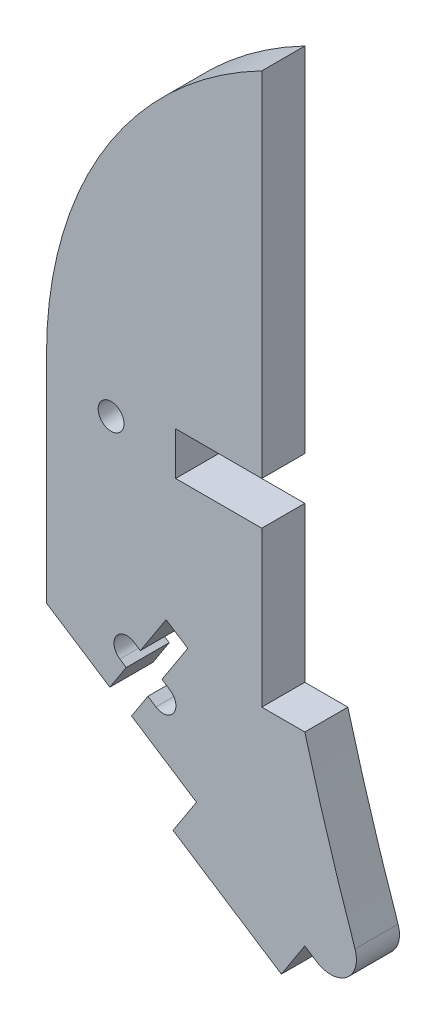
from build123d import *

# Parameters (mm, degrees)
SKETCH1_R           = 1.5
BOSS_EXTRUDE1_DEPTH = 5
BOSS_EXTRUDE2_DEPTH = 5


with BuildPart() as part:
    # Sketch1 → Boss-Extrude1 (new body)
    with BuildSketch(Plane.XY):
        with BuildLine():
            Line((-2.723195175, -4.19335284), (0, 0))
            Line((0, 0), (0, 21.523344663))
            Line((0, 21.523344663), (-5, 21.523344663))
            Line((-5, 21.523344663), (-5, 39.523344663))
            Line((-5, 39.523344663), (-15, 39.523344663))
            Line((-15, 39.523344663), (-15, 44.523344663))
            Line((-15, 44.523344663), (-5, 44.523344663))
            Line((-5, 44.523344663), (-5, 85.523344663))
            ThreePointArc((-5, 85.523344663), (-23.257079628, 68.53375907), (-30, 44.523344663))
            Line((-30, 44.523344663), (-30, 19.482227796))
            Line((-30, 19.482227796), (-22.644105335, 14.705253945))
            Line((-22.644105335, 14.705253945), (-20.737868712, 17.640600933))
            Line((-20.737868712, 17.640600933), (-21.480469057, 18.122851236))
            ThreePointArc((-21.480469057, 18.122851236), (-21.921516356, 20.19781564), (-19.846551952, 20.63886294))
            Line((-19.846551952, 20.63886294), (-19.103951607, 20.156612637))
            Line((-19.103951607, 20.156612637), (-16.108436914, 24.769300761))
            Line((-16.108436914, 24.769300761), (-13.592425211, 23.135383656))
            Line((-13.592425211, 23.135383656), (-16.587939903, 18.522695532))
            Line((-16.587939903, 18.522695532), (-15.653199112, 17.915667765))
            ThreePointArc((-15.653199112, 17.915667765), (-15.212151813, 15.84070336), (-17.287116217, 15.399656061))
            Line((-17.287116217, 15.399656061), (-18.221857008, 16.006683828))
            Line((-18.221857008, 16.006683828), (-20.128093631, 13.07133684))
            Line((-20.128093631, 13.07133684), (-12.580058519, 8.169585525))
            Line((-12.580058519, 8.169585525), (-15.303253694, 3.976232685))
            Line((-15.303253694, 3.976232685), (-2.723195175, -4.19335284))
        make_face()
        with Locations((-22.5, 42.023344663)):
            Circle(SKETCH1_R, mode=Mode.SUBTRACT)
    extrude(amount=BOSS_EXTRUDE1_DEPTH)

    # Sketch2 → Boss-Extrude2 (add)
    with BuildSketch(Plane.XY.offset(5)):
        with BuildLine():
            Line((0, 0), (1.366082895, -0.887144605))
            ThreePointArc((1.366082895, -0.887144605), (4.849577495, -0.733136942), (5.834405315, 2.61179462))
            ThreePointArc((5.834405315, 2.61179462), (2.753784423, 12.017153456), (0, 21.523344663))
            Line((0, 21.523344663), (0, 0))
        make_face()
    extrude(amount=-BOSS_EXTRUDE2_DEPTH)


solid = part.part
